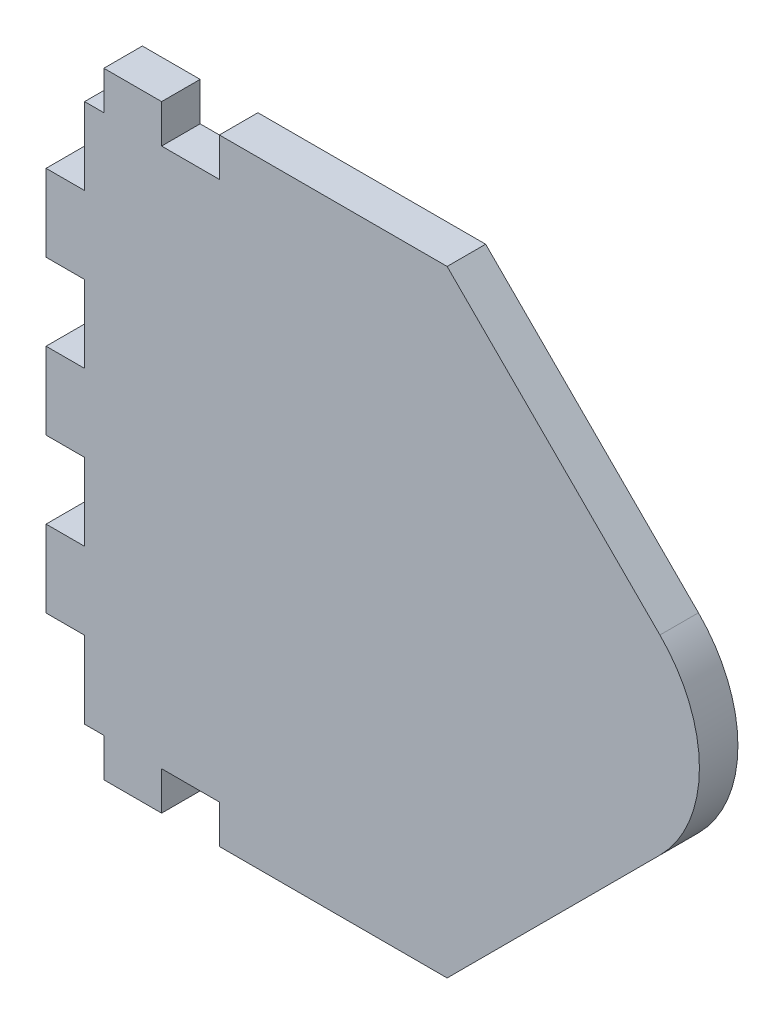
from build123d import *

# Parameters (mm, degrees)
BOSS_EXTRUDE1_DEPTH = 6.35
CAVITY2_START       = -19.05
CAVITY2_OUTLINE_W   = 19.05
CAVITY2_OUTLINE_H   = 6.35
CAVITY2_OUTLINE_W_2 = 12.7
CAVITY2_DEPTH       = 6.350000002
CAVITY2_2_OUTLINE_W = 6.35
CAVITY2_2_OUTLINE_H = 6.35
CAVITY2_2_DEPTH     = 9.525
CAVITY2_START_2     = -12.699999998
CAVITY2_3_OUTLINE_W = 6.35
CAVITY2_3_OUTLINE_H = 6.35
CAVITY2_3_DEPTH     = 3.174999998


# Read off the part's stored shape, not the designer's step: Cavity2
with BuildPart() as part:
    # Sketch1 → Boss-Extrude1 (new body)
    with BuildSketch(Plane.XY):
        with BuildLine():
            Line((-19.05, -37.547541155), (47.072541155, -37.547541155))
            Line((47.072541155, -37.547541155), (82.157092943, -72.632092943))
            ThreePointArc((82.157092943, -72.632092943), (88.666644731, -88.347541155), (82.157092943, -104.062989367))
            Line((82.157092943, -104.062989367), (47.072541155, -139.147541155))
            Line((47.072541155, -139.147541155), (-19.05, -139.147541155))
            Line((-19.05, -139.147541155), (-19.05, -37.547541155))
        make_face()
    extrude(amount=-BOSS_EXTRUDE1_DEPTH)

    # Cavity2 outline → Cavity2 (cut)
    with BuildSketch(Plane.YZ.offset(CAVITY2_START)):
        with Locations((-129.622541155, -3.175)):
            Rectangle(CAVITY2_OUTLINE_W, CAVITY2_OUTLINE_H)
        with Locations((-101.047541155, -3.175)):
            Rectangle(CAVITY2_OUTLINE_W_2, CAVITY2_OUTLINE_H)
        with Locations((-75.647541155, -3.175)):
            Rectangle(CAVITY2_OUTLINE_W_2, CAVITY2_OUTLINE_H)
        with Locations((-47.072541155, -3.175)):
            Rectangle(CAVITY2_OUTLINE_W, CAVITY2_OUTLINE_H)
    extrude(amount=CAVITY2_DEPTH, mode=Mode.SUBTRACT)

    # Cavity2 2 outline → Cavity2 2 (cut)
    with BuildSketch(Plane.YZ):
        with Locations((-135.972541155, -3.175)):
            Rectangle(CAVITY2_2_OUTLINE_W, CAVITY2_2_OUTLINE_H)
        with Locations((-40.722541155, -3.175)):
            Rectangle(CAVITY2_2_OUTLINE_W, CAVITY2_2_OUTLINE_H)
    extrude(amount=CAVITY2_2_DEPTH, mode=Mode.SUBTRACT)

    # Cavity2 3 outline → Cavity2 3 (cut)
    with BuildSketch(Plane.YZ.offset(CAVITY2_START_2)):
        with Locations((-135.972541155, -3.175)):
            Rectangle(CAVITY2_3_OUTLINE_W, CAVITY2_3_OUTLINE_H)
        with Locations((-40.722541155, -3.175)):
            Rectangle(CAVITY2_3_OUTLINE_W, CAVITY2_3_OUTLINE_H)
    extrude(amount=CAVITY2_3_DEPTH, mode=Mode.SUBTRACT)


solid = part.part
